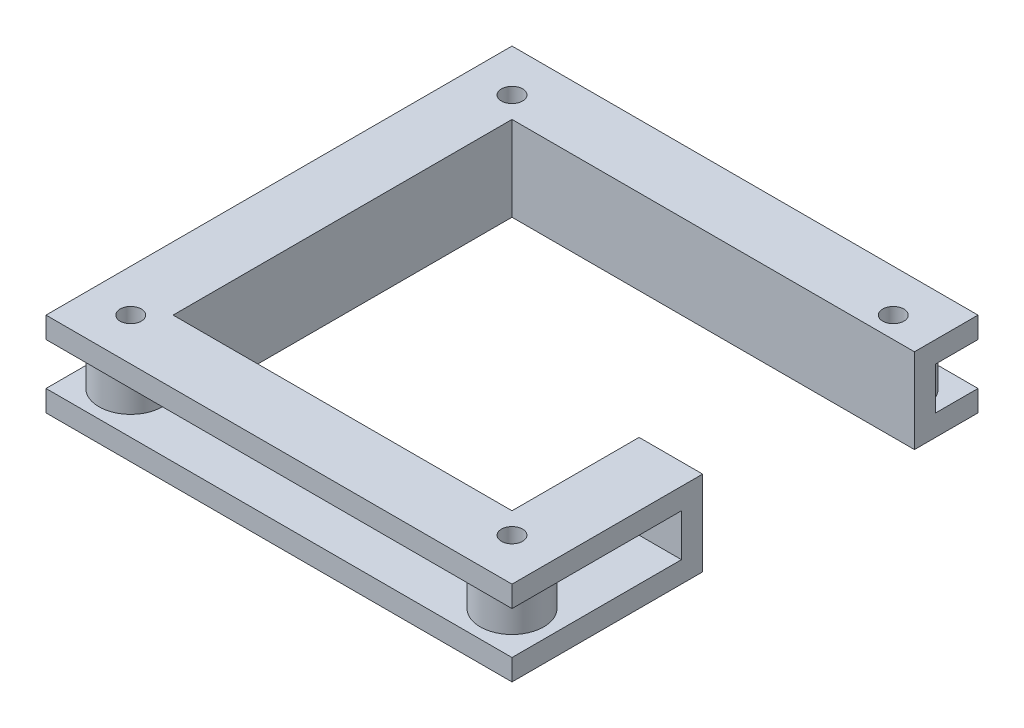
from build123d import *

# Parameters (mm, degrees)
SKETCH1_W           = 220
SKETCH1_H           = 220
SKETCH1_R           = 5
SKETCH1_W_2         = 160
SKETCH1_H_2         = 160
BOSS_EXTRUDE1_DEPTH = 40
SKETCH4_W           = 30
SKETCH4_H           = 100
CUT_EXTRUDE1_DEPTH  = 286.657137142
SHELL1_START        = 10
SHELL1_DEPTH        = 20


# Read off the part's stored shape, not the designer's step: Shell1
with BuildPart() as part:
    # Sketch1 → Boss-Extrude1 (new body)
    with BuildSketch(Plane(origin=(0, 0, 0), x_dir=(1, 0, 0), z_dir=(0, 1, 0))):
        with Locations((90, 90)):
            Rectangle(SKETCH1_W, SKETCH1_H)
        with Locations(Location((0, 180, 0), (0, 0, 270))):
            Circle(SKETCH1_R, mode=Mode.SUBTRACT)
        with Locations(Location((180, 180, 0), (0, 0, 270))):
            Circle(SKETCH1_R, mode=Mode.SUBTRACT)
        with Locations(Location((180, 0, 0), (0, 0, 270))):
            Circle(SKETCH1_R, mode=Mode.SUBTRACT)
        with Locations(Location((0, 0, 0), (0, 0, 270))):
            Circle(SKETCH1_R, mode=Mode.SUBTRACT)
        with Locations((90, 90)):
            Rectangle(SKETCH1_W_2, SKETCH1_H_2, mode=Mode.SUBTRACT)
    extrude(amount=BOSS_EXTRUDE1_DEPTH)

    # Sketch4 → Cut-Extrude1 (cut, through all)
    with BuildSketch(Plane(origin=(0, 40, 0), x_dir=(1, 0, 0), z_dir=(0, 1, 0))):
        with Locations((185, 120)):
            Rectangle(SKETCH4_W, SKETCH4_H)
    extrude(amount=-CUT_EXTRUDE1_DEPTH, mode=Mode.SUBTRACT)

    # Shell1 outline → Shell1 (cut)
    with BuildSketch(Plane(origin=(0, 0, 0), x_dir=(1, 0, 0), z_dir=(0, 1, 0)).offset(SHELL1_START)):
        with BuildLine():
            Line((15, 180), (165, 180))
            ThreePointArc((165, 180), (180, 195), (195, 180))
            Line((195, 180), (200, 180))
            Line((200, 180), (200, 200))
            Line((200, 200), (-20, 200))
            Line((-20, 200), (-20, -20))
            Line((-20, -20), (200, -20))
            Line((200, -20), (200, 60))
            Line((200, 60), (180, 60))
            Line((180, 60), (180, 15))
            ThreePointArc((180, 15), (190.606601718, -10.606601718), (165, 0))
            Line((165, 0), (15, 0))
            ThreePointArc((15, 0), (-10.606601718, -10.606601718), (0, 15))
            Line((0, 15), (0, 165))
            ThreePointArc((0, 165), (-10.606601718, 190.606601718), (15, 180))
        make_face()
    extrude(amount=SHELL1_DEPTH, mode=Mode.SUBTRACT)


solid = part.part
